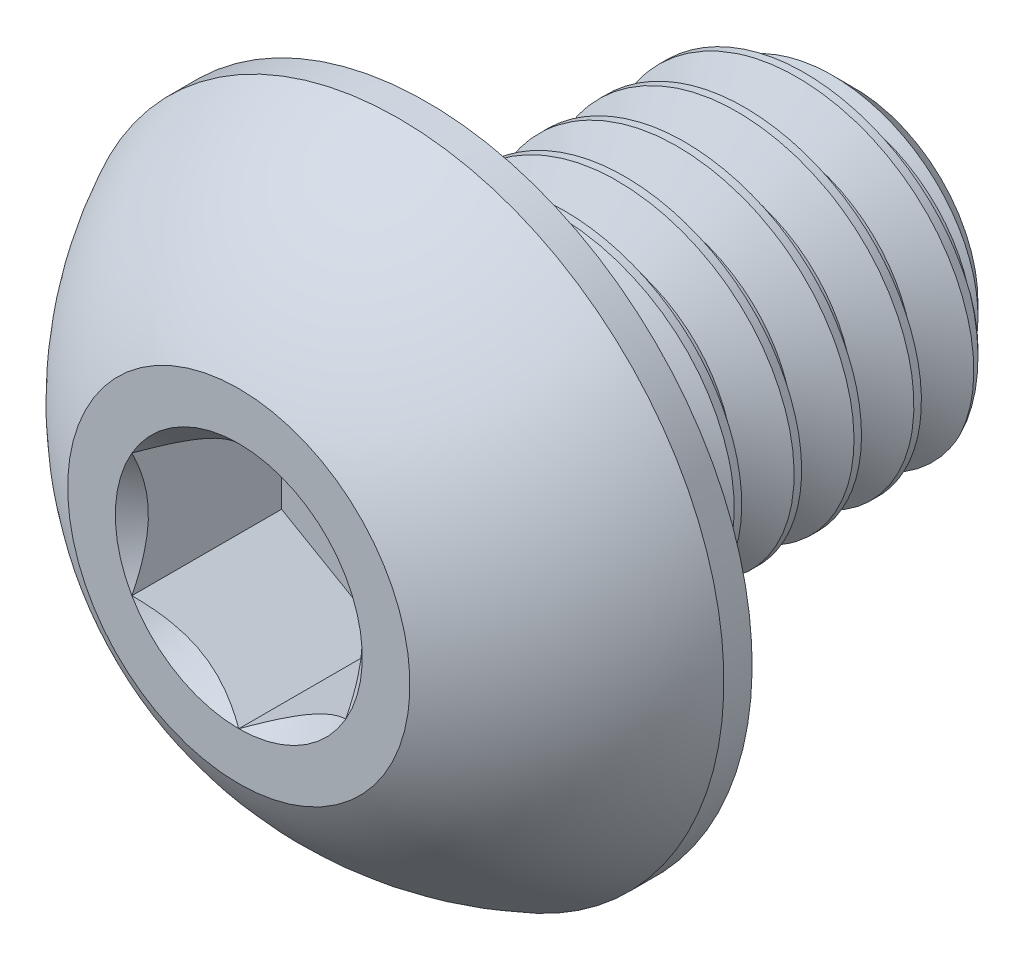
from build123d import *

# Parameters (mm, degrees)
CUT_EXTRUDE1_DEPTH = 1.75
CUT_SWEEP1_PITCH   = 0.7


# Read off the part's stored shape, not the designer's step: Split1
with BuildPart() as part:
    # Sketch2 → Revolve1 (revolve)
    with BuildSketch(Plane(origin=(0, 0, 0), x_dir=(0, 0, -1), z_dir=(1, 0, 0)), mode=Mode.PRIVATE) as revolve1_sk:
        with BuildLine():
            Line((-3.6, 0), (3.6, 0))
            Line((3.6, 0), (3.6, 1.44))
            Line((3.6, 1.44), (3.04, 2))
            Line((3.04, 2), (-1.4, 2))
            Line((-1.4, 2), (-1.4, 3.8))
            Line((-1.4, 3.8), (-1.73, 3.8))
            ThreePointArc((-1.73, 3.8), (-2.806499853, 3.047002626), (-3.6, 2))
            Line((-3.6, 2), (-3.6, 0))
        make_face()
    revolve(revolve1_sk.sketch.rotate(Axis((0, 0, 3.6), (0, 0, -1)), 180), axis=Axis((0, 0, 3.6), (0, 0, -1)))

    # Sketch3 → Cut-Extrude1 (cut)
    with BuildSketch(Plane.XY.offset(3.6)):
        Polygon((0, 1.443375673), (-1.25, 0.721687836), (-1.25, -0.721687836), (0, -1.443375673), (1.25, -0.721687836), (1.25, 0.721687836), align=None)
    extrude(amount=-CUT_EXTRUDE1_DEPTH, mode=Mode.SUBTRACT)

    # Cut-Extrude2 cone 1 section (through the dimple's axis) → Cut-Extrude2 (revolve, cut)
    with BuildSketch(Plane(origin=(0, 0, 3.6), x_dir=(0, -1, 0), z_dir=(1, 0, 0))):
        Polygon((0, 0), (1.443375673, 0), (0, 1.443375673), align=None)
    revolve(axis=Axis((0, 0, 3.6), (0, 0, -1)), mode=Mode.SUBTRACT)


with BuildPart() as body_2:
    # Split1: the piece on the far side of the plane
    add(part.part)
    split(bisect_by=Plane.XY.offset(1.4), keep=Keep.BOTTOM)

    # Cut-Sweep1: the profile of Sketch6 screwed along a right-hand helix of 8.142857 turns, 6 arcs to a turn; built about Z, then put on its axis
    cut_sweep1_z = Axis((0, 0, 0), (0, 0, 1))
    cut_sweep1_corners = [(1.545336663, 0, -0.2625), (1.545336663, 0, -0.35), (2.037888611, 0, -0.634375), (2.037888611, 0, 0.021875)]
    with BuildLine(mode=Mode.PRIVATE) as cut_sweep1_profile:
        Line(cut_sweep1_corners[0], cut_sweep1_corners[1])
        Line(cut_sweep1_corners[1], cut_sweep1_corners[2])
        Line(cut_sweep1_corners[2], cut_sweep1_corners[3])
        Line(cut_sweep1_corners[3], cut_sweep1_corners[0])
    cut_sweep1_cap = Face(cut_sweep1_profile.wire())
    cut_sweep1_turn_angles = [0, 30, 60, 90, 120, 150, 180, 210, 240, 270, 300, 330, 360]
    cut_sweep1_turn_weights = [1, 0.8660254037844387, 1, 0.8660254037844387, 1, 0.8660254037844387, 1, 0.8660254037844387, 1, 0.8660254037844387, 1, 0.8660254037844387, 1]
    cut_sweep1_turn_rails = [Edge.make_bspline([Vector(p[0], p[1], 0).rotate(cut_sweep1_z, cut_sweep1_turn_angles[k]) / cut_sweep1_turn_weights[k] + Vector(0, 0, p[2] + CUT_SWEEP1_PITCH * cut_sweep1_turn_angles[k] / 360) for k in range(13)], [0, 0, 0, 1, 1, 2, 2, 3, 3, 4, 4, 5, 5, 6, 6, 6], 2, cut_sweep1_turn_weights) for p in cut_sweep1_corners]
    cut_sweep1_turn_sides = [Face.make_surface_from_curves(cut_sweep1_turn_rails[p[0]], cut_sweep1_turn_rails[p[1]]) for p in [(0, 1), (1, 2), (2, 3), (3, 0)]]
    cut_sweep1_turn = Solid(Shell([*cut_sweep1_turn_sides, cut_sweep1_cap, cut_sweep1_cap.rotate(cut_sweep1_z, 360).moved(Location((0, 0, CUT_SWEEP1_PITCH * 360 / 360)))]))
    cut_sweep1_last_angles = [2880, 2905.714285714, 2931.428571429]
    cut_sweep1_last_weights = [1, 0.9009688679023619, 1]
    cut_sweep1_last_rails = [Edge.make_bspline([Vector(p[0], p[1], 0).rotate(cut_sweep1_z, cut_sweep1_last_angles[k]) / cut_sweep1_last_weights[k] + Vector(0, 0, p[2] + CUT_SWEEP1_PITCH * cut_sweep1_last_angles[k] / 360) for k in range(3)], [0, 0, 0, 1, 1, 1], 2, cut_sweep1_last_weights) for p in cut_sweep1_corners]
    cut_sweep1_last_sides = [Face.make_surface_from_curves(cut_sweep1_last_rails[p[0]], cut_sweep1_last_rails[p[1]]) for p in [(0, 1), (1, 2), (2, 3), (3, 0)]]
    cut_sweep1_last = Solid(Shell([*cut_sweep1_last_sides, cut_sweep1_cap.rotate(cut_sweep1_z, 2880).moved(Location((0, 0, CUT_SWEEP1_PITCH * 2880 / 360))), cut_sweep1_cap.rotate(cut_sweep1_z, 2931.428571429).moved(Location((0, 0, CUT_SWEEP1_PITCH * 2931.428571429 / 360)))]))
    cut_sweep1_each = [*[cut_sweep1_turn.moved(Location((0, 0, CUT_SWEEP1_PITCH * i))) for i in range(8)], cut_sweep1_last]
    add(Plane(origin=(0, 0, -3.6), x_dir=(0, 1, 0), z_dir=(0, 0, 1)) * Compound([cut_sweep1_each[i] for i in range(0, 9, 2)]), mode=Mode.SUBTRACT)
    add(Plane(origin=(0, 0, -3.6), x_dir=(0, 1, 0), z_dir=(0, 0, 1)) * Compound([cut_sweep1_each[i] for i in range(1, 9, 2)]), mode=Mode.SUBTRACT)


with BuildPart() as part_1:
    add(part.part)

    # Split1
    split(bisect_by=Plane.XY.offset(1.4), keep=Keep.TOP)

    add(body_2.part)  # Boss-Extrude1 merges body 2
    # Boss-Extrude1 cone 1 section (through the dimple's axis) → Boss-Extrude1 (revolve)
    with BuildSketch(Plane(origin=(0, 0, 1.4), x_dir=(0, -1, 0), z_dir=(1, 0, 0))):
        Polygon((0, 0), (2, 0), (0, 3.464101615), align=None)
    revolve(axis=Axis((0, 0, 1.4), (0, 0, -1)))


solid = part_1.part
